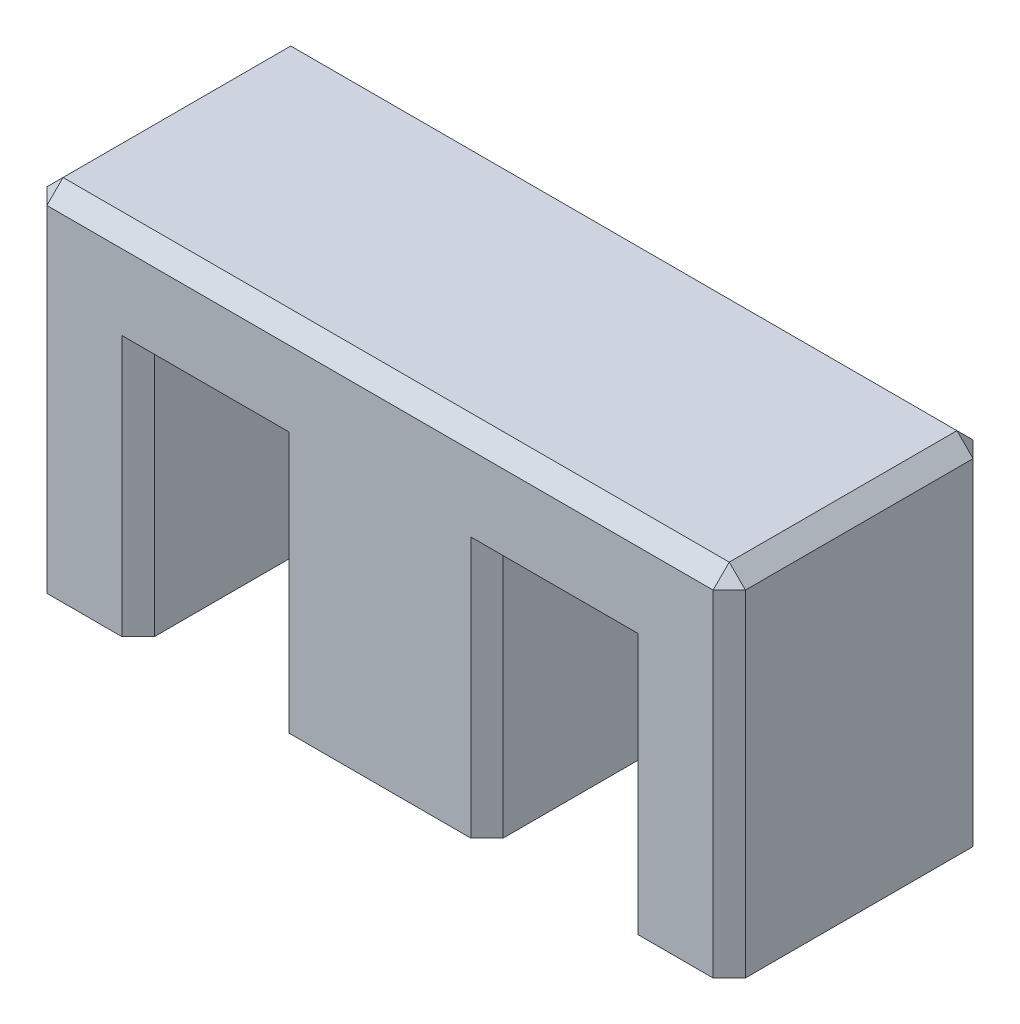
from build123d import *

# Parameters (mm, degrees)
BOSS_EXTRUDE1_DEPTH = 16.1
CHAMFER1_SIZE       = 2


with BuildPart() as part:
    # Sketch1 → Boss-Extrude1 (new, symmetric)
    with BuildSketch(Plane.XY):
        Polygon((43.25, 31.173529412), (-43.25, 31.173529412), (-43.25, -12.426470588), (-29.95, -12.426470588), (-29.95, 17.873529412), (-13.25, 17.873529412), (-13.25, -12.426470588), (13.25, -12.426470588), (13.25, 17.873529412), (29.95, 17.873529412), (29.95, -12.426470588), (43.25, -12.426470588), align=None)
    extrude(amount=BOSS_EXTRUDE1_DEPTH, both=True)

    # Chamfer1
    chamfer1_edges = [part.edges().sort_by_distance(p)[0] for p in [
        (43.25, 31.173529412, 0),
        (43.25, 9.373529412, 16.1),
        (0, 31.173529412, 16.1),
        (-43.25, 9.373529412, 16.1),
        (-43.25, 31.173529412, 0),
        (-43.25, 9.373529412, -16.1),
        (0, 31.173529412, -16.1),
        (43.25, 9.373529412, -16.1),
        (13.25, 2.723529412, -16.1),
        (29.95, 2.723529412, -16.1),
        (21.6, 17.873529412, -16.1),
        (-29.95, 2.723529412, -16.1),
        (-13.25, 2.723529412, -16.1),
        (-21.6, 17.873529412, -16.1),
        (29.95, 2.723529412, 16.1),
        (13.25, 2.723529412, 16.1),
        (21.6, 17.873529412, 16.1),
        (-29.95, 2.723529412, 16.1),
        (-13.25, 2.723529412, 16.1),
        (-21.6, 17.873529412, 16.1),
    ]]
    chamfer(chamfer1_edges, length=CHAMFER1_SIZE)


solid = part.part
